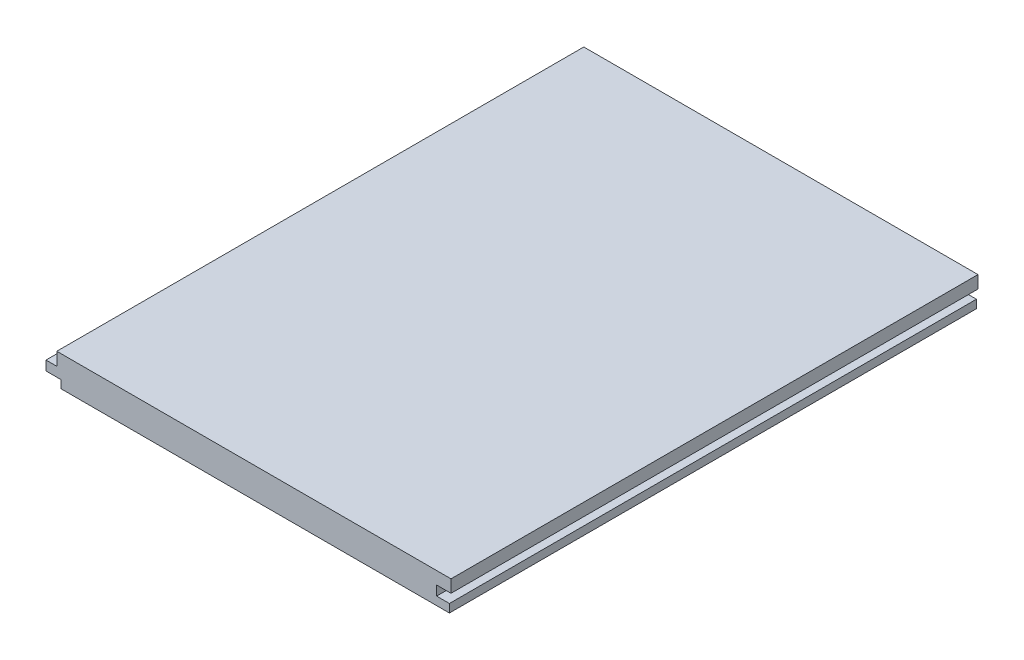
from build123d import *

# Parameters (mm, degrees)
BOSS_EXTRUDE1_DEPTH = 127


with BuildPart() as part:
    # Sketch1 → Boss-Extrude1 (new, symmetric)
    with BuildSketch(Plane.XY):
        Polygon((-100.203, -3.5179), (-92.964, -3.5179), (-92.964, -7.3279), (94.234, -7.3279), (94.234, -3.3401), (88.0745, -3.3401), (88.0745, 1.2827), (94.996, 1.2827), (94.996, 7.3279), (-94.996, 7.3279), (-94.996, 1.0541), (-100.203, 1.0541), align=None)
    extrude(amount=BOSS_EXTRUDE1_DEPTH, both=True)


solid = part.part
